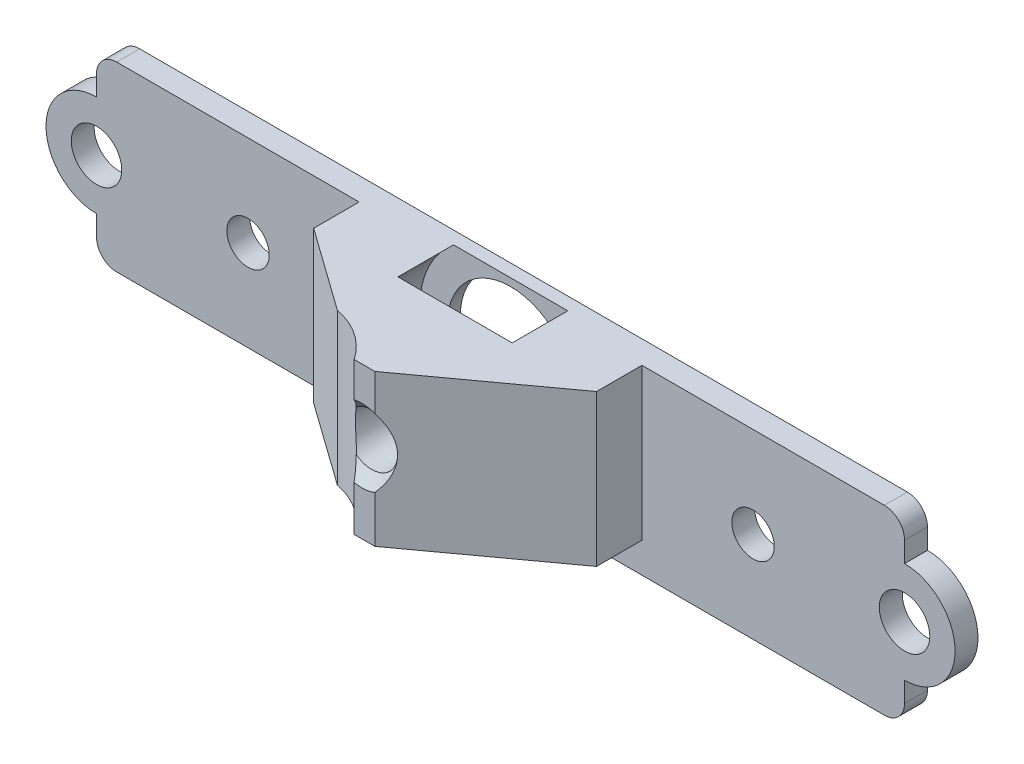
from build123d import *

# Parameters (mm, degrees)
BOSS_EXTRUDE1_DEPTH            = 15
CHAMFER1_SIZE                  = 1.802121321
CHAMFER2_SIZE                  = 1.802121321
CUT_EXTRUDE1_REACH             = 26.607
BOSS_EXTRUDE2_DEPTH            = 2.271122456
CUT_EXTRUDE2_REACH             = 52.66
F_4_2_4_2_DIAMETER_HOLE1_D     = 4.2
F_4_2_4_2_DIAMETER_HOLE1_DEPTH = 16.017925233
F_4_2_4_2_DIAMETER_HOLE2_D     = 4.2
F_4_2_4_2_DIAMETER_HOLE2_DEPTH = 16.017925233
F_5_0_5_DIAMETER_HOLE1_D       = 5
F_5_0_5_DIAMETER_HOLE2_D       = 5


with BuildPart() as part:
    # Sketch1 → Boss-Extrude1 (new body)
    with BuildSketch(Plane(origin=(0, 18, 0), x_dir=(1, 0, 0), z_dir=(0, 1, 0))):
        with BuildLine():
            Line((14, -6.5), (14, -2))
            Line((14, -2), (-14, -2))
            Line((-14, -2), (-14, -6.5))
            Line((-14, -6.5), (-5.822354851, -12.337757006))
            ThreePointArc((-5.822354851, -12.337757006), (-2.456495727, -13.897392525), (-0.156010119, -16.807587804))
            Line((-0.156010119, -16.807587804), (14, -6.5))
        make_face()
    extrude(amount=-BOSS_EXTRUDE1_DEPTH)

    # Sketch2 → Hole1 (revolve, cut)
    with BuildSketch(Plane(origin=(0, 11, 16.807587804), x_dir=(0, -1, 0), z_dir=(1, 0, 0))):
        Polygon((0, 0), (0, 10.007587804), (2, 10.007587804), (2.69979871, 0), align=None)
    revolve(axis=Axis((0, 11, -93.192412196), (0, 0, 1)), mode=Mode.SUBTRACT)

    # Chamfer1
    # the kernel refuses this chamfer: 1.802121321, 1.16968541 mm, written as the material it takes off along each edge
    with BuildSketch(Plane(origin=(-0.156010119, 12.956909278, 16.807587804), x_dir=(0.8084016240923299, 0, -0.5886313057975113), z_dir=(0, -1, 0))) as chamfer1_piece_1:
        with BuildLine():
            Line((CHAMFER1_SIZE, 0), (0.14359278, -1.207644556))
            ThreePointArc((0.14359278, -1.207644556), (0.096853733, -0.618716026), (0, 0))
            Line((0, 0), (CHAMFER1_SIZE, 0))
        make_face()
    extrude(amount=14.60910591, mode=Mode.SUBTRACT)

    # Chamfer2
    # the kernel refuses this chamfer: 1.802121321, 1.16968541 mm, written as the material it takes off along each edge
    with BuildSketch(Plane(origin=(-0.156010119, 22.652196632, 16.807587804), x_dir=(0.8084016240923299, 0, -0.5886313057975113), z_dir=(0, -1, 0))) as chamfer2_piece_1:
        with BuildLine():
            Line((CHAMFER2_SIZE, 0), (0.14359278, -1.207644556))
            ThreePointArc((0.14359278, -1.207644556), (0.096853733, -0.618716026), (0, 0))
            Line((0, 0), (CHAMFER2_SIZE, 0))
        make_face()
    extrude(amount=13.60910591, mode=Mode.SUBTRACT)

    # Chamfer3: read off the stored shape, not the designer's step
    # Chamfer3 outline → Chamfer3 (revolve, cut)
    with BuildSketch(Plane.XZ.offset(-11)):
        Polygon((2.555864922, 15.746802777), (2.555864922, 14.749238727), (3.625621395, 15.746802777), align=None)
    revolve(axis=Axis((0, 11, 0), (0, 0, 1)), mode=Mode.SUBTRACT)

    # Sketch4 → Cut-Extrude1 (cut, up to next)
    with BuildSketch(Plane.XY.offset(6.5), mode=Mode.PRIVATE) as cut_extrude1_sk1:
        with BuildLine():
            Line((9, 3), (9, 11))
            ThreePointArc((9, 11), (8.121320344, 14.878679656), (5.656854249, 18))
            Line((5.656854249, 18), (-5.656854249, 18))
            ThreePointArc((-5.656854249, 18), (-8.121320344, 14.878679656), (-9, 11))
            Line((-9, 11), (-9, 3))
            Line((-9, 3), (9, 3))
        make_face()
    cut_extrude1_tool1 = extrude(cut_extrude1_sk1.sketch, amount=-CUT_EXTRUDE1_REACH, mode=Mode.PRIVATE) & part.part
    add(cut_extrude1_tool1.solids().sort_by_distance((0, 10.176322, 6.5))[0], mode=Mode.SUBTRACT)

    # Sketch5 → Boss-Extrude2 (add)
    with BuildSketch(Plane.XY.offset(2)):
        with BuildLine():
            Line((-6.25, 0), (-6.25, 11))
            ThreePointArc((-6.25, 11), (0, 17.25), (6.25, 11))
            Line((6.25, 11), (6.25, 0))
            Line((6.25, 0), (38, 0))
            ThreePointArc((38, 0), (39.414213562, 0.585786438), (40, 2))
            Line((40, 2), (40, 4))
            ThreePointArc((40, 4), (45, 9), (40, 14))
            Line((40, 14), (40, 16))
            ThreePointArc((40, 16), (39.414213562, 17.414213562), (38, 18))
            Line((38, 18), (-38, 18))
            ThreePointArc((-38, 18), (-39.414213562, 17.414213562), (-40, 16))
            Line((-40, 16), (-40, 14))
            ThreePointArc((-40, 14), (-45, 9), (-40, 4))
            Line((-40, 4), (-40, 2))
            ThreePointArc((-40, 2), (-39.414213562, 0.585786438), (-38, 0))
            Line((-38, 0), (-6.25, 0))
        make_face()
    extrude(amount=-BOSS_EXTRUDE2_DEPTH)

    # Sketch6 → Cut-Extrude2 (cut, up to next)
    with BuildSketch(Plane(origin=(0, 0, 1), x_dir=(-1, 0, 0), z_dir=(0, 0, -1)), mode=Mode.PRIVATE) as cut_extrude2_sk1:
        with BuildLine():
            Line((-9, 11), (-9, 0))
            Line((-9, 0), (-6.25, 0))
            Line((-6.25, 0), (-6.25, 11))
            ThreePointArc((-6.25, 11), (0, 17.25), (6.25, 11))
            Line((6.25, 11), (6.25, 0))
            Line((6.25, 0), (9, 0))
            Line((9, 0), (9, 11))
            ThreePointArc((9, 11), (8.121320344, 14.878679656), (5.656854249, 18))
            Line((5.656854249, 18), (-5.656854249, 18))
            ThreePointArc((-5.656854249, 18), (-8.121320344, 14.878679656), (-9, 11))
        make_face()
    cut_extrude2_tool1 = extrude(cut_extrude2_sk1.sketch, amount=-CUT_EXTRUDE2_REACH, mode=Mode.PRIVATE) & part.part
    add(cut_extrude2_tool1.solids().sort_by_distance((7.891615, 14.768974, 1))[0], mode=Mode.SUBTRACT)

    # Ø4.2 (4.2) Diameter Hole1
    with Locations(Plane(origin=(0, 0, -0.271122456), x_dir=(-1, 0, 0), z_dir=(0, 0, -1))):
        with Locations((25, 9)):
            Hole(F_4_2_4_2_DIAMETER_HOLE1_D / 2, depth=F_4_2_4_2_DIAMETER_HOLE1_DEPTH)

    # Ø4.2 (4.2) Diameter Hole2
    with Locations(Plane(origin=(0, 0, -0.271122456), x_dir=(-1, 0, 0), z_dir=(0, 0, -1))):
        with Locations((-25, 9)):
            Hole(F_4_2_4_2_DIAMETER_HOLE2_D / 2, depth=F_4_2_4_2_DIAMETER_HOLE2_DEPTH)

    # Ø5.0 (5) Diameter Hole1 (through all)
    with Locations(Plane.XY.offset(2)):
        with Locations((40, 9)):
            Hole(F_5_0_5_DIAMETER_HOLE1_D / 2)

    # Ø5.0 (5) Diameter Hole2 (through all)
    with Locations(Plane.XY.offset(2)):
        with Locations((-40, 9)):
            Hole(F_5_0_5_DIAMETER_HOLE2_D / 2)


solid = part.part
